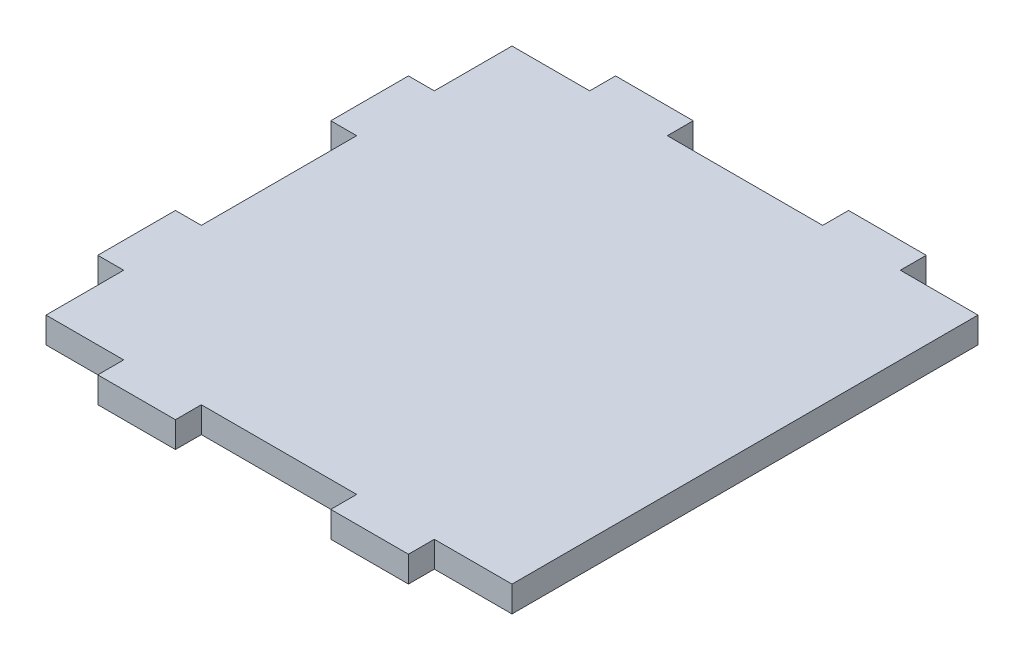
from build123d import *

# Parameters (mm, degrees)
BOSS_EXTRUDE1_DEPTH = 6.35


with BuildPart() as part:
    # Sketch1 → Boss-Extrude1 (new body)
    with BuildSketch(Plane(origin=(0, 0, 0), x_dir=(1, 0, 0), z_dir=(0, 1, 0))):
        Polygon((0, 0), (19.05, 0), (19.05, -6.35), (38.1, -6.35), (38.1, 0), (76.2, 0), (76.2, -6.35), (95.25, -6.35), (95.25, 0), (114.3, 0), (114.3, 114.3), (95.25, 114.3), (95.25, 120.65), (76.2, 120.65), (76.2, 114.3), (38.1, 114.3), (38.1, 120.65), (19.05, 120.65), (19.05, 114.3), (0, 114.3), (0, 95.25), (-6.35, 95.25), (-6.35, 76.2), (0, 76.2), (0, 38.1), (-6.35, 38.1), (-6.35, 19.05), (0, 19.05), align=None)
    extrude(amount=-BOSS_EXTRUDE1_DEPTH)


solid = part.part
